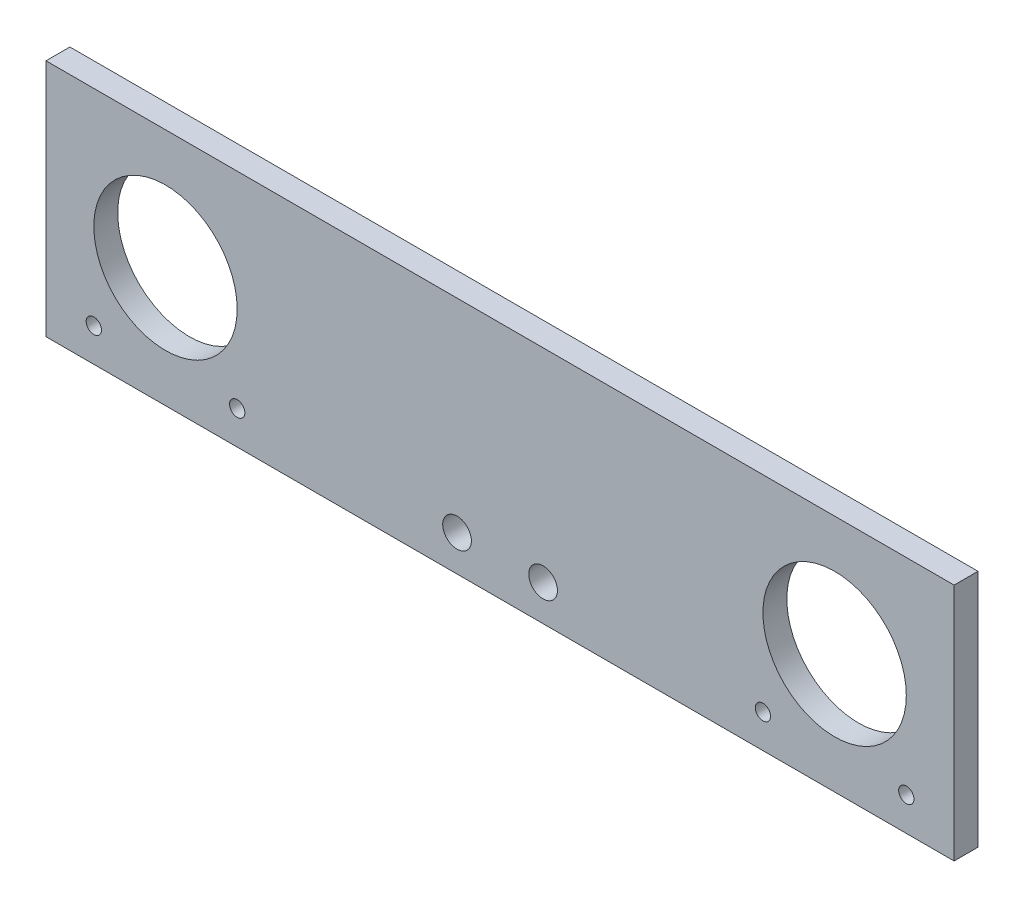
from build123d import *

# Parameters (mm, degrees)
SKETCH1_W           = 190
SKETCH1_H           = 50
SKETCH1_R           = 1.6
SKETCH1_R_2         = 3
SKETCH1_R_3         = 15
BOSS_EXTRUDE1_DEPTH = 5


with BuildPart() as part:
    # Sketch1 → Boss-Extrude1 (new body)
    with BuildSketch(Plane.XY):
        with Locations((95, 25)):
            Rectangle(SKETCH1_W, SKETCH1_H)
        with Locations((10, 7)):
            Circle(SKETCH1_R, mode=Mode.SUBTRACT)
        with Locations((40, 7)):
            Circle(SKETCH1_R, mode=Mode.SUBTRACT)
        with Locations((86, 7.5)):
            Circle(SKETCH1_R_2, mode=Mode.SUBTRACT)
        with Locations((25, 25)):
            Circle(SKETCH1_R_3, mode=Mode.SUBTRACT)
        with Locations((104, 7.5)):
            Circle(SKETCH1_R_2, mode=Mode.SUBTRACT)
        with Locations((150, 7)):
            Circle(SKETCH1_R, mode=Mode.SUBTRACT)
        with Locations((180, 7)):
            Circle(SKETCH1_R, mode=Mode.SUBTRACT)
        with Locations((165, 25)):
            Circle(SKETCH1_R_3, mode=Mode.SUBTRACT)
    extrude(amount=BOSS_EXTRUDE1_DEPTH)


solid = part.part
